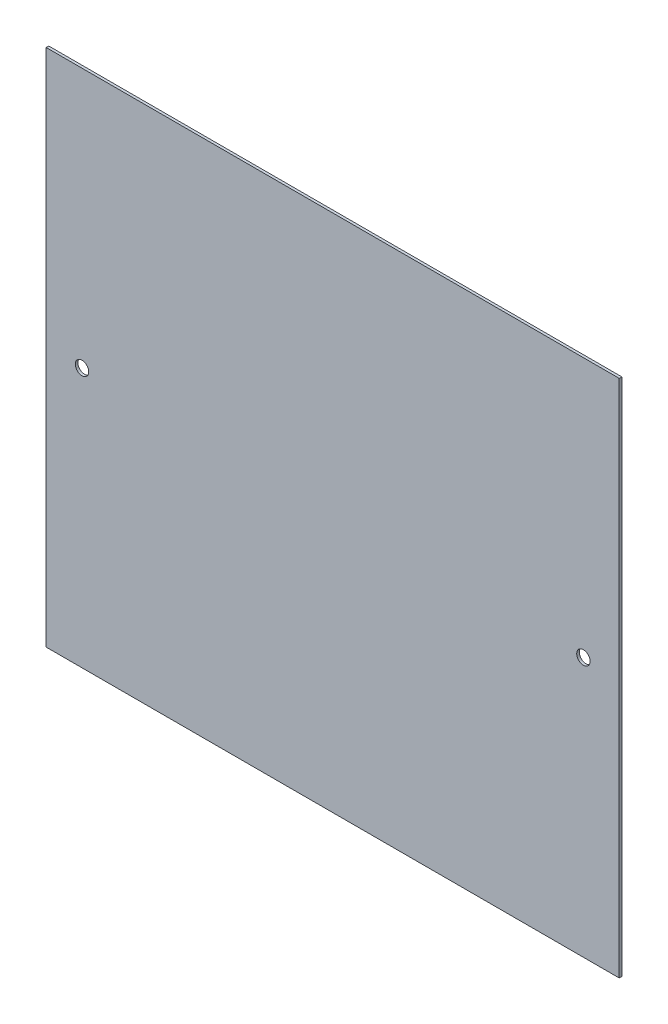
from build123d import *

# Parameters (mm, degrees)
SKETCH2_W               = 288
SKETCH2_H               = 261
BOSS_EXTRUDE1_DEPTH     = 1.2954
F_1_4_CLEARANCE_HOLE1_D = 6.7564


with BuildPart() as part:
    # Sketch2 → Boss-Extrude1 (new body)
    with BuildSketch(Plane.XY):
        Rectangle(SKETCH2_W, SKETCH2_H)
    extrude(amount=BOSS_EXTRUDE1_DEPTH)

    # 1/4 Clearance Hole1 (through all)
    with Locations(Plane.XY.offset(1.2954)):
        with Locations((-126, 0), (126, 0)):
            Hole(F_1_4_CLEARANCE_HOLE1_D / 2)


solid = part.part
